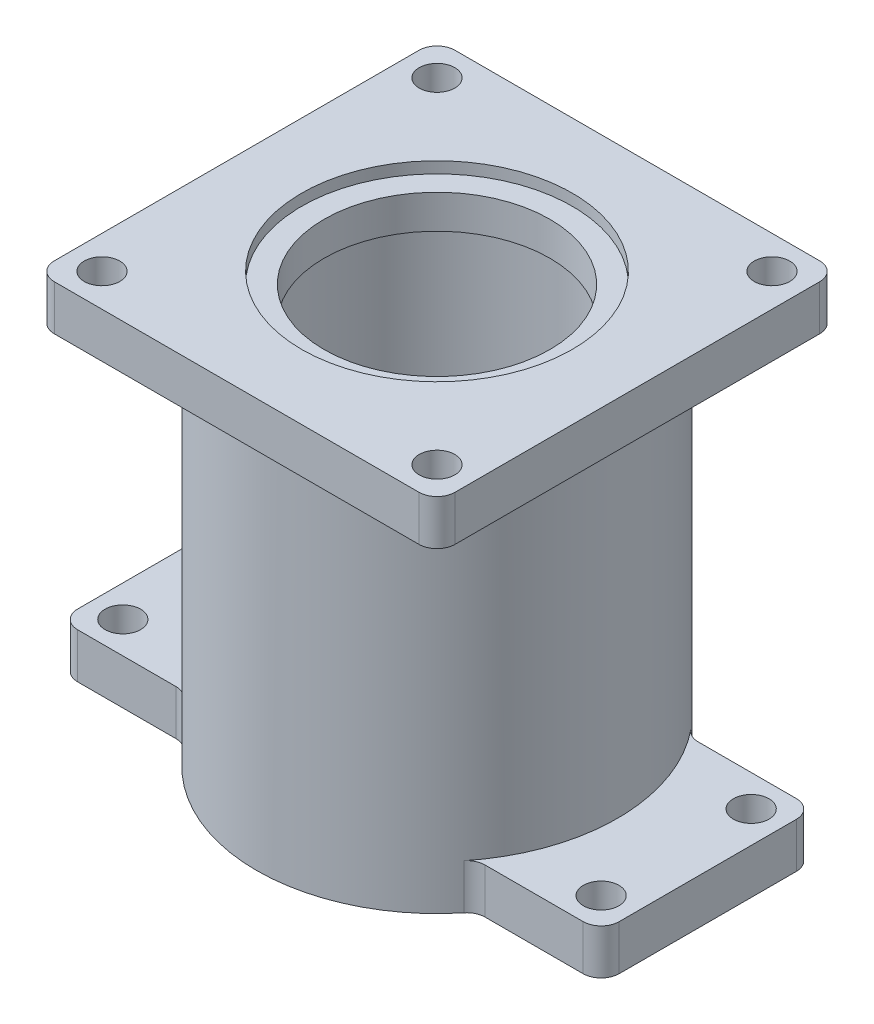
from build123d import *

# Parameters (mm, degrees)
SKETCH2_W           = 56.399999976
SKETCH2_H           = 56.399999976
SKETCH2_R           = 15.8877
SKETCH2_R_2         = 2.499999953
BOSS_EXTRUDE1_DEPTH = 6.35
SKETCH2_4_R         = 19.05
SKETCH2_4_R_2       = 15.8877
CUT_EXTRUDE2_DEPTH  = 1.600000102
SKETCH3_R           = 25.4
SKETCH3_R_2         = 19.05
BOSS_EXTRUDE2_DEPTH = 47.625
SKETCH4_R           = 2.5
SKETCH4_R_2         = 7.62
BOSS_EXTRUDE3_DEPTH = 6.35
FILLET1_R           = 2.54


with BuildPart() as part:
    # Sketch2 → Boss-Extrude1 (new body)
    with BuildSketch(Plane(origin=(0, 0, 0), x_dir=(1, 0, 0), z_dir=(0, 1, 0))):
        Rectangle(SKETCH2_W, SKETCH2_H)
        with Locations(Location((0, 0, 0), (0, 0, 270))):
            Circle(SKETCH2_R, mode=Mode.SUBTRACT)
        with Locations(Location((23.569999977, 23.569999977, 0), (0, 0, 270))):
            Circle(SKETCH2_R_2, mode=Mode.SUBTRACT)
        with Locations(Location((23.569999977, -23.569999977, 0), (0, 0, 270))):
            Circle(SKETCH2_R_2, mode=Mode.SUBTRACT)
        with Locations(Location((-23.569999977, -23.569999977, 0), (0, 0, 270))):
            Circle(SKETCH2_R_2, mode=Mode.SUBTRACT)
        with Locations(Location((-23.569999977, 23.569999977, 0), (0, 0, 270))):
            Circle(SKETCH2_R_2, mode=Mode.SUBTRACT)
    extrude(amount=-BOSS_EXTRUDE1_DEPTH)

    # Sketch2<4> → Cut-Extrude2 (cut)
    with BuildSketch(Plane(origin=(0, 0, 0), x_dir=(1, 0, 0), z_dir=(0, 1, 0))):
        with Locations(Location((0, 0, 0), (0, 0, 270))):
            Circle(SKETCH2_4_R)
        with Locations(Location((0, 0, 0), (0, 0, 270))):
            Circle(SKETCH2_4_R_2, mode=Mode.SUBTRACT)
    extrude(amount=-CUT_EXTRUDE2_DEPTH, mode=Mode.SUBTRACT)

    # Sketch3 → Boss-Extrude2 (add)
    with BuildSketch(Plane.XZ.offset(6.35)):
        with Locations(Location((0, 0, 0), (0, 0, 270))):
            Circle(SKETCH3_R)
        with Locations(Location((0, 0, 0), (0, 0, 90))):
            Circle(SKETCH3_R_2, mode=Mode.SUBTRACT)
    extrude(amount=BOSS_EXTRUDE2_DEPTH)

    # Sketch4 → Boss-Extrude3 (add)
    with BuildSketch(Plane.XZ.offset(53.975)):
        with BuildLine():
            Line((38.1, -14.999999972), (38.1, 14.999999972))
            Line((38.1, 14.999999972), (20.497804781, 14.999999972))
            ThreePointArc((20.497804781, 14.999999972), (0, 25.4), (-20.497804781, 14.999999972))
            Line((-20.497804781, 14.999999972), (-38.1, 14.999999972))
            Line((-38.1, 14.999999972), (-38.1, -14.999999972))
            Line((-38.1, -14.999999972), (-20.497804781, -14.999999972))
            ThreePointArc((-20.497804781, -14.999999972), (0, -25.4), (20.497804781, -14.999999972))
            Line((20.497804781, -14.999999972), (38.1, -14.999999972))
        make_face()
        with Locations(Location((-33.655, -10.554999972, 0), (0, 0, 270))):
            Circle(SKETCH4_R, mode=Mode.SUBTRACT)
        with Locations(Location((0, 0, 0), (0, 0, 270))):
            Circle(SKETCH4_R_2, mode=Mode.SUBTRACT)
        with Locations(Location((-33.655, 10.554999972, 0), (0, 0, 270))):
            Circle(SKETCH4_R, mode=Mode.SUBTRACT)
        with Locations(Location((33.655, -10.554999972, 0), (0, 0, 270))):
            Circle(SKETCH4_R, mode=Mode.SUBTRACT)
        with Locations(Location((33.655, 10.554999972, 0), (0, 0, 270))):
            Circle(SKETCH4_R, mode=Mode.SUBTRACT)
    extrude(amount=BOSS_EXTRUDE3_DEPTH)

    # Fillet1
    # the kernel refuses this fillet: 2.54 mm, written as the material it adds along each edge
    with BuildSketch(Plane(origin=(20.497804781, -53.975, 14.999999972), x_dir=(-0.6093303633188096, 0, 0.7929164573508154), z_dir=(0, -1, 0)), Plane(origin=(-20.497804781, -53.975, -14.999999972), x_dir=(0.609330363318784, 0, -0.7929164573508352), z_dir=(0, -1, 0))) as fillet1_piece_1:
        with BuildLine():
            CenterArc((1.251994792, -2.539300218), FILLET1_R, 91.344968241, 51.113932151)
            Line((-0.762013009, -0.991601095), (0, 0))
            ThreePointArc((0, 0), (0.596187996, -0.006997817), (1.192375993, 0))
        make_face()
    extrude(amount=6.35)
    with BuildSketch(Plane(origin=(-20.497804781, -53.975, 14.999999972), x_dir=(0.6093303633187793, 0, 0.7929164573508387), z_dir=(0, -1, 0)), Plane(origin=(20.497804781, -53.975, -14.999999972), x_dir=(-0.609330363318815, 0, -0.7929164573508114), z_dir=(0, -1, 0))) as fillet1_piece_2:
        with BuildLine():
            CenterArc((1.251994792, 2.539300218), FILLET1_R, 217.541099608, 51.113932151)
            Line((-0.762013009, 0.991601095), (0, 0))
            ThreePointArc((0, 0), (0.596187996, 0.006997817), (1.192375993, 0))
        make_face()
    extrude(amount=6.35)
    # the kernel refuses this fillet: 2.54 mm, written as the material it takes off along each edge
    with BuildSketch(Plane(origin=(-28.199999988, 6.35, -28.199999988), x_dir=(0, 0, 1), z_dir=(0, -1, 0)), Plane(origin=(-28.199999988, 6.35, 28.199999988), x_dir=(1, 0, 0), z_dir=(0, -1, 0)), Plane(origin=(38.1, -47.625, -14.999999972), x_dir=(-1, 0, 0), z_dir=(0, -1, 0)), Plane(origin=(38.1, -47.625, 14.999999972), x_dir=(0, 0, -1), z_dir=(0, -1, 0))) as fillet1_2_piece_1:
        with BuildLine():
            CenterArc((FILLET1_R, -FILLET1_R), FILLET1_R, 90, 90)
            Line((0, -FILLET1_R), (0, 0))
            Line((0, 0), (FILLET1_R, 0))
        make_face()
    extrude(amount=19.05, mode=Mode.SUBTRACT)
    with BuildSketch(Plane(origin=(28.199999988, 6.35, -28.199999988), x_dir=(0, 0, 1), z_dir=(0, -1, 0)), Plane(origin=(28.199999988, 6.35, 28.199999988), x_dir=(-1, 0, 0), z_dir=(0, -1, 0)), Plane(origin=(-38.1, -47.625, 14.999999972), x_dir=(0, 0, -1), z_dir=(0, -1, 0)), Plane(origin=(-38.1, -47.625, -14.999999972), x_dir=(1, 0, 0), z_dir=(0, -1, 0))) as fillet1_2_piece_2:
        with BuildLine():
            CenterArc((FILLET1_R, FILLET1_R), FILLET1_R, 180, 90)
            Line((0, FILLET1_R), (0, 0))
            Line((0, 0), (FILLET1_R, 0))
        make_face()
    extrude(amount=19.05, mode=Mode.SUBTRACT)


solid = part.part
